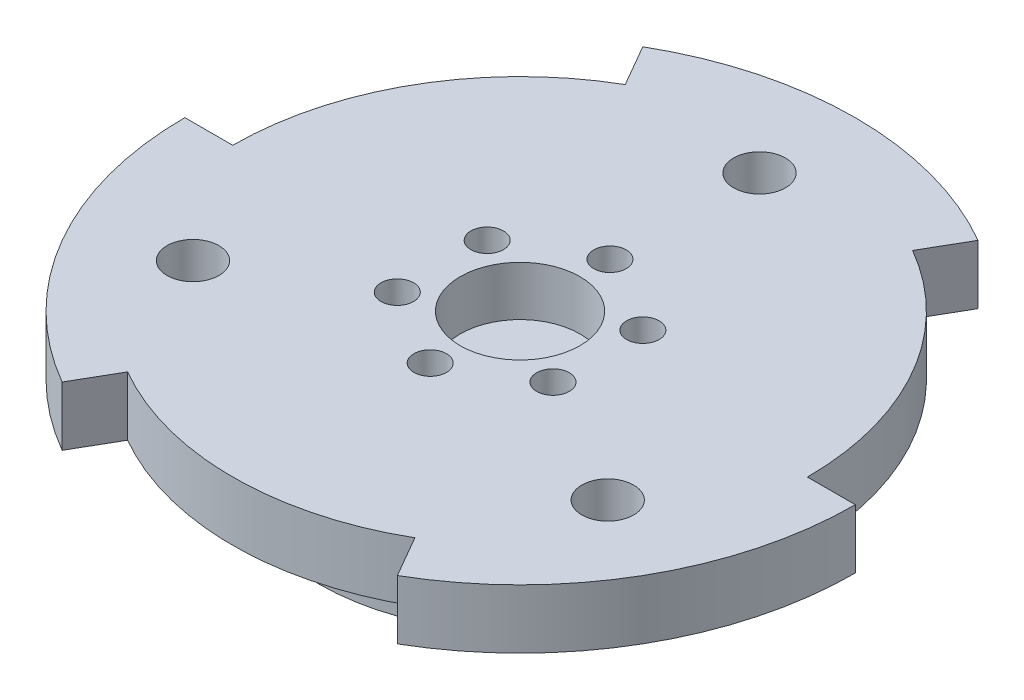
from build123d import *

# Parameters (mm, degrees)
SKETCH7_W               = 22.627416998
SKETCH7_H               = 22.627416998
SKETCH7_R               = 16.1
BOSS_EXTRUDE2_DEPTH     = 8.2
SKETCH1_R               = 2.707265749
SKETCH1_R_2             = 6.25
BOSS_EXTRUDE1_DEPTH     = 5.18
CUT_EXTRUDE1_DEPTH      = 52.274012911
CUT_EXTRUDE1_DEPTH_BACK = 52.274012911
SKETCH6_R               = 1.7
SKETCH9_R               = 2.707265749
SKETCH9_R_2             = 6.25
SKETCH9_R_3             = 1.7
CUT_EXTRUDE2_DEPTH      = 52.274012911
BOSS_EXTRUDE3_START     = 9
SKETCH10_R              = 21
SKETCH10_R_2            = 16.1
BOSS_EXTRUDE3_DEPTH     = 9
CHAMFER1_SIZE           = 1.5
BOSS_EXTRUDE4_START     = 1
SKETCH11_R              = 2.707265749
BOSS_EXTRUDE4_DEPTH     = 1


with BuildPart() as part:
    # Sketch7 → Boss-Extrude2 (new body)
    with BuildSketch(Plane(origin=(0, 0, 0), x_dir=(1, 0, 0), z_dir=(0, 1, 0))):
        Rectangle(SKETCH7_W, SKETCH7_H)
        with Locations(Location((0, 0, 0), (0, 0, 270))):
            Circle(SKETCH7_R)
        Rectangle(SKETCH7_W, SKETCH7_H)
    extrude(amount=BOSS_EXTRUDE2_DEPTH)

    # Sketch1 → Boss-Extrude1 (add)
    with BuildSketch(Plane(origin=(0, 8.2, 0), x_dir=(1, 0, 0), z_dir=(0, 1, 0))):
        with BuildLine():
            Line((15, 25.980762114), (17.5, 30.310889132))
            ThreePointArc((17.5, 30.310889132), (0, 35), (-17.5, 30.310889132))
            Line((-17.5, 30.310889132), (-15, 25.980762114))
            ThreePointArc((-15, 25.980762114), (-25.980762114, 15), (-30, 0))
            Line((-30, 0), (-35, 0))
            ThreePointArc((-35, 0), (-30.310889132, -17.5), (-17.5, -30.310889132))
            Line((-17.5, -30.310889132), (-15, -25.980762114))
            ThreePointArc((-15, -25.980762114), (0, -30), (15, -25.980762114))
            Line((15, -25.980762114), (17.5, -30.310889132))
            ThreePointArc((17.5, -30.310889132), (30.310889132, -17.5), (35, 0))
            Line((35, 0), (30, 0))
            ThreePointArc((30, 0), (25.980762114, 15), (15, 25.980762114))
        make_face()
        with Locations(Location((21.650635095, -12.5, 0), (0, 0, 270))):
            Circle(SKETCH1_R, mode=Mode.SUBTRACT)
        with Locations(Location((-21.650635095, -12.5, 0), (0, 0, 270))):
            Circle(SKETCH1_R, mode=Mode.SUBTRACT)
        with Locations(Location((0, 0, 0), (0, 0, 270))):
            Circle(SKETCH1_R_2, mode=Mode.SUBTRACT)
        with Locations(Location((0, 25, 0), (0, 0, 270))):
            Circle(SKETCH1_R, mode=Mode.SUBTRACT)
    extrude(amount=BOSS_EXTRUDE1_DEPTH)

    # Sketch6 → Cut-Extrude1 (cut, two sides: drawn at the far end of the back side and taken through both)
    with BuildSketch(Plane(origin=(0, 13.38, 0), x_dir=(1, 0, 0), z_dir=(0, 1, 0)).offset(-CUT_EXTRUDE1_DEPTH_BACK)):
        with Locations(Location((0, -9.385, 0), (0, 0, 90))):
            Circle(SKETCH6_R)
        with Locations(Location((-8.127648415, -4.6925, 0), (0, 0, 90))):
            Circle(SKETCH6_R)
        with Locations(Location((-8.127648415, 4.6925, 0), (0, 0, 90))):
            Circle(SKETCH6_R)
        with Locations(Location((0, 9.385, 0), (0, 0, 90))):
            Circle(SKETCH6_R)
        with Locations(Location((8.127648415, 4.6925, 0), (0, 0, 90))):
            Circle(SKETCH6_R)
        with Locations(Location((8.127648415, -4.6925, 0), (0, 0, 90))):
            Circle(SKETCH6_R)
    extrude(amount=CUT_EXTRUDE1_DEPTH + CUT_EXTRUDE1_DEPTH_BACK, mode=Mode.SUBTRACT)

    # Sketch9 → Cut-Extrude2 (cut, through all)
    with BuildSketch(Plane(origin=(0, 13.38, 0), x_dir=(1, 0, 0), z_dir=(0, 1, 0))):
        with Locations(Location((-21.650635095, -12.5, 0), (0, 0, 270))):
            Circle(SKETCH9_R)
        with Locations(Location((0, 0, 0), (0, 0, 270))):
            Circle(SKETCH9_R_2)
        with Locations(Location((21.650635095, -12.5, 0), (0, 0, 270))):
            Circle(SKETCH9_R)
        with Locations(Location((0, 25, 0), (0, 0, 270))):
            Circle(SKETCH9_R)
        with Locations(Location((8.127648415, -4.6925, 0), (0, 0, 90))):
            Circle(SKETCH9_R_3)
        with Locations(Location((8.127648415, 4.6925, 0), (0, 0, 90))):
            Circle(SKETCH9_R_3)
        with Locations(Location((0, 9.385, 0), (0, 0, 90))):
            Circle(SKETCH9_R_3)
        with Locations(Location((-8.127648415, 4.6925, 0), (0, 0, 90))):
            Circle(SKETCH9_R_3)
        with Locations(Location((-8.127648415, -4.6925, 0), (0, 0, 90))):
            Circle(SKETCH9_R_3)
    extrude(amount=-CUT_EXTRUDE2_DEPTH, mode=Mode.SUBTRACT)

    # Sketch10 → Boss-Extrude3 (add)
    with BuildSketch(Plane.XZ.offset(-8.2).offset(BOSS_EXTRUDE3_START)):
        with Locations(Location((0, 0, 0), (0, 0, 90))):
            Circle(SKETCH10_R)
        with Locations(Location((0, 0, 0), (0, 0, 90))):
            Circle(SKETCH10_R_2, mode=Mode.SUBTRACT)
    extrude(amount=-BOSS_EXTRUDE3_DEPTH)

    # Chamfer1
    # the kernel refuses this chamfer: 1.5 mm, written as the material it takes off along each edge
    with BuildSketch(Plane(origin=(0, -0.8, 0), x_dir=(0, 0, 1), z_dir=(1, 0, 0))) as chamfer1_piece_1_section:
        Polygon((16.1, -CHAMFER1_SIZE), (16.1 + CHAMFER1_SIZE, 0), (16.1, 0), align=None)
    chamfer1_piece_1 = revolve(axis=Axis((0, -0.8, 0), (0, -1, 0)), mode=Mode.PRIVATE)
    chamfer1_piece_1 = split(chamfer1_piece_1, bisect_by=Plane(origin=(0, 0, -17.188347783), z_dir=(0, -1, 0)), keep=Keep.TOP, mode=Mode.PRIVATE)
    add(chamfer1_piece_1, mode=Mode.SUBTRACT)

    # Sketch11 → Boss-Extrude4 (add)
    with BuildSketch(Plane.XZ.offset(-8.2).offset(BOSS_EXTRUDE4_START)):
        with BuildLine():
            Line((-35, 0), (-30, 0))
            ThreePointArc((-30, 0), (-25.980762114, -15), (-15, -25.980762114))
            Line((-15, -25.980762114), (-17.5, -30.310889132))
            ThreePointArc((-17.5, -30.310889132), (0, -35), (17.5, -30.310889132))
            Line((17.5, -30.310889132), (15, -25.980762114))
            ThreePointArc((15, -25.980762114), (25.980762114, -15), (30, 0))
            Line((30, 0), (35, 0))
            ThreePointArc((35, 0), (30.310889132, 17.5), (17.5, 30.310889132))
            Line((17.5, 30.310889132), (15, 25.980762114))
            ThreePointArc((15, 25.980762114), (0, 30), (-15, 25.980762114))
            Line((-15, 25.980762114), (-17.5, 30.310889132))
            ThreePointArc((-17.5, 30.310889132), (-30.310889132, 17.5), (-35, 0))
        make_face()
        with Locations(Location((21.650635095, 12.5, 0), (0, 0, 270))):
            Circle(SKETCH11_R, mode=Mode.SUBTRACT)
        with Locations(Location((0, -25, 0), (0, 0, 270))):
            Circle(SKETCH11_R, mode=Mode.SUBTRACT)
        with Locations(Location((-21.650635095, 12.5, 0), (0, 0, 270))):
            Circle(SKETCH11_R, mode=Mode.SUBTRACT)
    extrude(amount=-BOSS_EXTRUDE4_DEPTH)


solid = part.part
